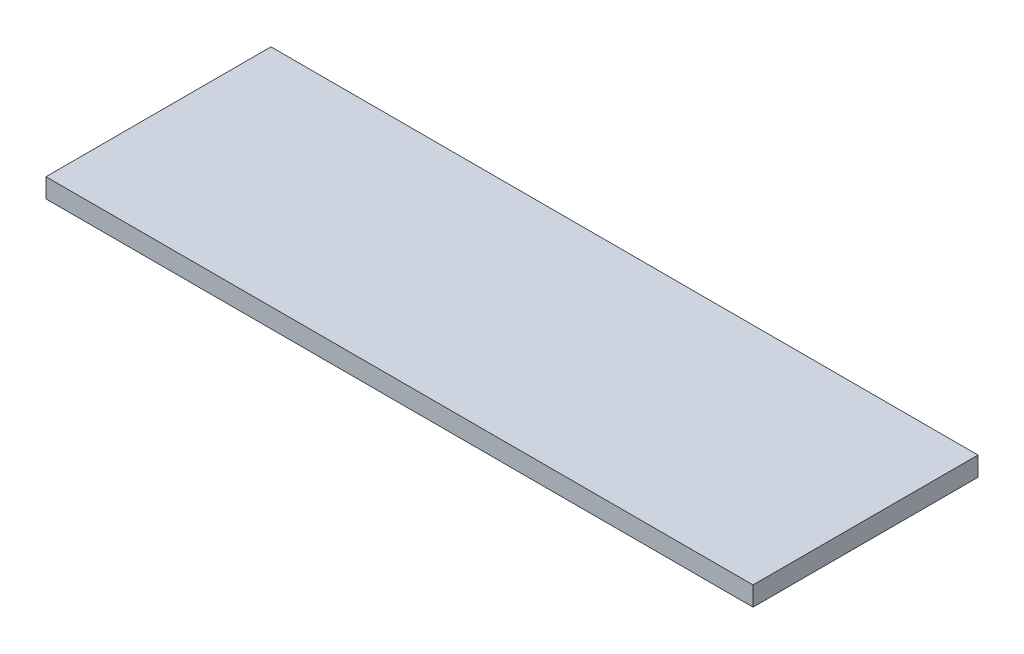
from build123d import *

# Parameters (mm, degrees)
SKETCH1_W           = 220
SKETCH1_H           = 70
BOSS_EXTRUDE1_DEPTH = 6


with BuildPart() as part:
    # Sketch1 → Boss-Extrude1 (new body)
    with BuildSketch(Plane(origin=(0, 0, 0), x_dir=(1, 0, 0), z_dir=(0, 1, 0))):
        with Locations((-251.905099867, 35)):
            Rectangle(SKETCH1_W, SKETCH1_H)
    extrude(amount=BOSS_EXTRUDE1_DEPTH)


solid = part.part
